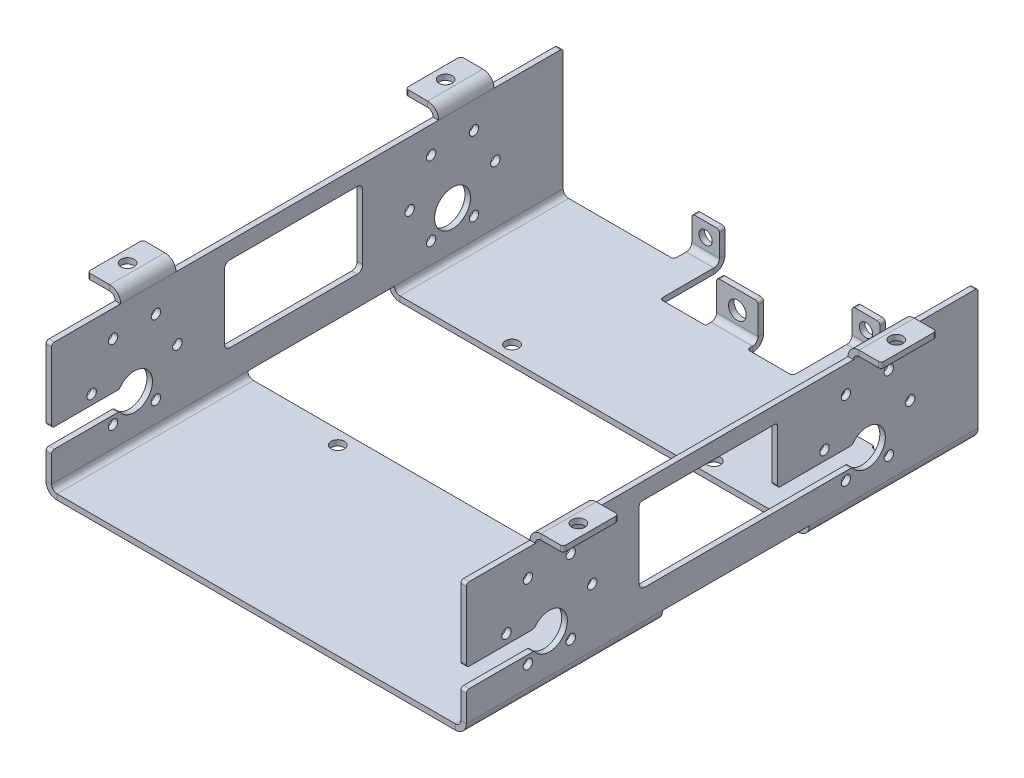
from build123d import *

# Parameters (mm, degrees)
BASIS_BLECH1_DEPTH                    = 185
SCHNITT_LINEAR_AUSTRAGEN1_DEPTH       = 10
SCHNITT_LINEAR_AUSTRAGEN1_DEPTH_BACK  = 206.224267571
SKIZZE2_R                             = 6.5
SKIZZE5_W                             = 50
SKIZZE5_H                             = 27.5
SCHNITT_LINEAR_AUSTRAGEN3_DEPTH       = 244.813453279
DURCHGANGSLOCH_F_R_M31_D              = 3.4
KANTE_LASCHE1_DEPTH                   = 20
F_4_7_4_79_DURCHMESSER_BOHRUNG1_D     = 4.79
SPIEGELN2_COPY_1_DEPTH                = 20
SPIEGELN2_COPY_2_D                    = 4.79
LINEARES_MUSTER1_COUNT                = 2
LINEARES_MUSTER1_PITCH                = 115
F_4_7_4_79_DURCHMESSER_BOHRUNG2_D     = 4.79
F_4_7_4_79_DURCHMESSER_BOHRUNG2_DEPTH = 10
F_4_7_4_79_DURCHMESSER_BOHRUNG2_TIP   = 1.439061183
SCHNITT_LINEAR_AUSTRAGEN4_DEPTH       = 10
KANTE_LASCHE3_DEPTH                   = 10
KANTE_LASCHE3_START                   = 2
KANTE_LASCHE3_PROFILE_W               = 10
KANTE_LASCHE3_PROFILE_H               = 9
KANTE_LASCHE3_PROFILE_R               = 2.395
KANTE_LASCHE3_FLAT_DEPTH              = 2
SKIZZE44_W                            = 48
SKIZZE44_H                            = 15
SCHNITT_LINEAR_AUSTRAGEN5_DEPTH       = 218.573550782
KANTE_LASCHE4_DEPTH                   = 15
KANTE_LASCHE4_START                   = 2
KANTE_LASCHE4_PROFILE_W               = 15
KANTE_LASCHE4_PROFILE_H               = 11
KANTE_LASCHE4_PROFILE_R               = 3.2
KANTE_LASCHE4_FLAT_DEPTH              = 2
SCHNITT_LINEAR_AUSTRAGEN6_DEPTH       = 218.573550782
SCHNITT_LINEAR_AUSTRAGEN7_DEPTH       = 218.573550782
F_2_0_2_DURCHMESSER_BOHRUNG1_D        = 2
F_2_0_2_DURCHMESSER_BOHRUNG1_DEPTH    = 10
F_2_0_2_DURCHMESSER_BOHRUNG1_TIP      = 0.600860619
VERRUNDUNG2_R                         = 1
SCHNITT_LINEAR_START                  = -4
SCHNITT_LINEAR_AUSTRAGEN8_OUTLINE_W   = 154
SCHNITT_LINEAR_AUSTRAGEN8_OUTLINE_H   = 53
SCHNITT_LINEAR_AUSTRAGEN8_DEPTH       = 4
VERRUNDUNG4_R                         = 0.2
VERRUNDUNG1_R                         = 2


# Read off the part's stored shape, not the designer's step: Schnitt-Linear austragen8
# Sheet-metal steps are written as plain solids
with BuildPart() as part:
    # Skizze1 → Basis-Blech1 (new body)
    with BuildSketch(Plane.XY):
        with BuildLine():
            Line((-74, 46), (-74, 2))
            ThreePointArc((-74, 2), (-73.414213562, 0.585786438), (-72, 0))
            Line((-72, 0), (72, 0))
            ThreePointArc((72, 0), (73.414213562, 0.585786438), (74, 2))
            Line((74, 2), (74, 46))
            Line((74, 46), (76, 46))
            Line((76, 46), (76, 2))
            ThreePointArc((76, 2), (74.828427125, -0.828427125), (72, -2))
            Line((72, -2), (-72, -2))
            ThreePointArc((-72, -2), (-74.828427125, -0.828427125), (-76, 2))
            Line((-76, 2), (-76, 46))
            Line((-76, 46), (-74, 46))
        make_face()
    extrude(amount=-BASIS_BLECH1_DEPTH)

    # Skizze2 → Schnitt-Linear austragen1 (cut, two sides: drawn at the far end of the back side and taken through both)
    with BuildSketch(Plane(origin=(0, 0, 0), x_dir=(0, 0, -1), z_dir=(1, 0, 0)).offset(-SCHNITT_LINEAR_AUSTRAGEN1_DEPTH_BACK)):
        with Locations((145, 16)):
            Circle(SKIZZE2_R)
        with BuildLine():
            Line((0, 12.5), (24.522774425, 12.5))
            ThreePointArc((24.522774425, 12.5), (36.5, 16), (24.522774425, 19.5))
            Line((24.522774425, 19.5), (0, 19.5))
            Line((0, 19.5), (0, 12.5))
        make_face()
    extrude(amount=SCHNITT_LINEAR_AUSTRAGEN1_DEPTH + SCHNITT_LINEAR_AUSTRAGEN1_DEPTH_BACK, mode=Mode.SUBTRACT)

    # Skizze5 → Schnitt-Linear austragen3 (cut, through all)
    with BuildSketch(Plane(origin=(76, 0, 0), x_dir=(0, 0, -1), z_dir=(1, 0, 0))):
        with Locations((87.5, 26.25)):
            Rectangle(SKIZZE5_W, SKIZZE5_H)
    extrude(amount=-SCHNITT_LINEAR_AUSTRAGEN3_DEPTH, mode=Mode.SUBTRACT)

    # Durchgangsloch für M31 (through all)
    with Locations(Plane(origin=(76, 0, 0), x_dir=(0, 0, -1), z_dir=(1, 0, 0))):
        with Locations((22.25, 36.423393759), (37.75, 36.423393759), (45.5, 23), (37.75, 9.576606241), (22.25, 9.576606241), (14.5, 23)):
            durchgangsloch_f_r_m31 = Hole(DURCHGANGSLOCH_F_R_M31_D / 2)

    # Kante-Lasche1 section (across the edge) → Kante-Lasche1 (add)
    with BuildSketch(Plane(origin=(-76, 48, -25), x_dir=(0, -1, 0), z_dir=(0, 0, -1))):
        with BuildLine():
            Line((-2, 2), (-2, 10))
            Line((-2, 10), (0, 10))
            Line((0, 10), (0, 2))
            ThreePointArc((0, 2), (0.585786438, 0.585786438), (2, 0))
            Line((2, 0), (2, -2))
            ThreePointArc((2, -2), (-0.828427125, -0.828427125), (-2, 2))
        make_face()
    kante_lasche1 = extrude(amount=KANTE_LASCHE1_DEPTH)

    # Ø4.7 (4.79) Durchmesser Bohrung1 (through all)
    with Locations(Plane(origin=(0, 50, 0), x_dir=(1, 0, 0), z_dir=(0, 1, 0))):
        with Locations((-81.5, 35)):
            f_4_7_4_79_durchmesser_bohrung1 = Hole(F_4_7_4_79_DURCHMESSER_BOHRUNG1_D / 2)

    # Spiegeln1: Kante-Lasche1, Ø4.7 (4.79) Durchmesser Bohrung1 across plane
    add(kante_lasche1.mirror(Plane(origin=(0, 0, 0), x_dir=(0, 0, 1), z_dir=(1, 0, 0))))
    add(f_4_7_4_79_durchmesser_bohrung1.mirror(Plane(origin=(0, 0, 0), x_dir=(0, 0, 1), z_dir=(1, 0, 0))), mode=Mode.SUBTRACT)

    # Spiegeln2: Kante-Lasche1, Ø4.7 (4.79) Durchmesser Bohrung1 across plane
    add(kante_lasche1.mirror(Plane(origin=(0, 0, -92.5), x_dir=(1, 0, 0), z_dir=(0, 0, -1))))
    add(f_4_7_4_79_durchmesser_bohrung1.mirror(Plane(origin=(0, 0, -92.5), x_dir=(1, 0, 0), z_dir=(0, 0, -1))), mode=Mode.SUBTRACT)

    # Spiegeln2 copy 1 sketch → Spiegeln2 copy 1 (add)
    with BuildSketch(Plane(origin=(76, 48, -160), x_dir=(0, -1, 0), z_dir=(0, 0, 1))):
        with BuildLine():
            Line((-2, 2), (-2, 10))
            Line((-2, 10), (0, 10))
            Line((0, 10), (0, 2))
            ThreePointArc((0, 2), (0.585786438, 0.585786438), (2, 0))
            Line((2, 0), (2, -2))
            ThreePointArc((2, -2), (-0.828427125, -0.828427125), (-2, 2))
        make_face()
    extrude(amount=SPIEGELN2_COPY_1_DEPTH)

    # Spiegeln2 copy 2 (through all)
    with Locations(Plane(origin=(0, 50, -185), x_dir=(-1, 0, 0), z_dir=(0, 1, 0))):
        with Locations((-81.5, 35)):
            Hole(SPIEGELN2_COPY_2_D / 2)

    # Lineares Muster1: Durchgangsloch für M31 ×2
    with Locations(*[(0, 0, -i * LINEARES_MUSTER1_PITCH) for i in range(1, LINEARES_MUSTER1_COUNT)]):
        add(durchgangsloch_f_r_m31, mode=Mode.SUBTRACT)

    # Ø4.7 (4.79) Durchmesser Bohrung2
    with Locations(Plane(origin=(0, 0, 0), x_dir=(1, 0, 0), z_dir=(0, 1, 0))):
        with Locations((36.5, 129), (-36.5, 129), (-36.5, 66), (36.5, 66)):
            Hole(F_4_7_4_79_DURCHMESSER_BOHRUNG2_D / 2, depth=F_4_7_4_79_DURCHMESSER_BOHRUNG2_DEPTH)
            with Locations((0, 0, -(F_4_7_4_79_DURCHMESSER_BOHRUNG2_DEPTH + F_4_7_4_79_DURCHMESSER_BOHRUNG2_TIP / 2))):  # 118° drill point
                Cone(0, F_4_7_4_79_DURCHMESSER_BOHRUNG2_D / 2, F_4_7_4_79_DURCHMESSER_BOHRUNG2_TIP, mode=Mode.SUBTRACT)

    # Skizze31 → Schnitt-Linear austragen4 (cut)
    with BuildSketch(Plane.XZ.offset(2)):
        with BuildLine():
            Line((61.55, -177.3), (38.45, -177.3))
            Line((38.45, -177.3), (38.45, -171))
            Line((38.45, -171), (35.75, -171))
            ThreePointArc((35.75, -171), (34.75, -170), (35.75, -169))
            Line((35.75, -169), (38.45, -169))
            Line((38.45, -169), (38.45, -162.7))
            Line((38.45, -162.7), (61.55, -162.7))
            Line((61.55, -162.7), (61.55, -169))
            Line((61.55, -169), (64.25, -169))
            ThreePointArc((64.25, -169), (65.25, -170), (64.25, -171))
            Line((64.25, -171), (61.55, -171))
            Line((61.55, -171), (61.55, -177.3))
        make_face()
    extrude(amount=-SCHNITT_LINEAR_AUSTRAGEN4_DEPTH, mode=Mode.SUBTRACT)

    # Kante-Lasche3 bend section (across the edge) → Kante-Lasche3 (add)
    with BuildSketch(Plane(origin=(34, 0, -191.5), x_dir=(0, 0, 1), z_dir=(-1, 0, 0))):
        with BuildLine():
            Line((-2, 2), (0, 2))
            ThreePointArc((0, 2), (0.585786438, 0.585786438), (2, 0))
            Line((2, 0), (6.5, 0))
            Line((6.5, 0), (6.5, -2))
            Line((6.5, -2), (2, -2))
            ThreePointArc((2, -2), (-0.828427125, -0.828427125), (-2, 2))
        make_face()
    kante_lasche3 = extrude(amount=KANTE_LASCHE3_DEPTH)

    # Kante-Lasche3 profile (on flange) → Kante-Lasche3 flat (add)
    with BuildSketch(Plane(origin=(0, 0, -191.5), x_dir=(-1, 0, 0), z_dir=(0, 0, -1)).offset(KANTE_LASCHE3_START)):
        with Locations((-29, 6.5)):
            Rectangle(KANTE_LASCHE3_PROFILE_W, KANTE_LASCHE3_PROFILE_H)
        with Locations((-29, 6)):
            Circle(KANTE_LASCHE3_PROFILE_R, mode=Mode.SUBTRACT)
    kante_lasche3_flat = extrude(amount=-KANTE_LASCHE3_FLAT_DEPTH)

    # Spiegeln3: Kante-Lasche3, Kante-Lasche3 flat across plane
    add(kante_lasche3.mirror(Plane(origin=(0, 0, 0), x_dir=(0, 0, 1), z_dir=(1, 0, 0))))
    add(kante_lasche3_flat.mirror(Plane(origin=(0, 0, 0), x_dir=(0, 0, 1), z_dir=(1, 0, 0))))

    # Skizze44 → Schnitt-Linear austragen5 (cut, through all)
    with BuildSketch(Plane(origin=(0, 0, 0), x_dir=(1, 0, 0), z_dir=(0, 1, 0))):
        with Locations((0, 177.5)):
            Rectangle(SKIZZE44_W, SKIZZE44_H)
    extrude(amount=-SCHNITT_LINEAR_AUSTRAGEN5_DEPTH, mode=Mode.SUBTRACT)

    # Kante-Lasche4 bend section (across the edge) → Kante-Lasche4 (add)
    with BuildSketch(Plane(origin=(7.5, 0, -174), x_dir=(0, 0, 1), z_dir=(-1, 0, 0))):
        with BuildLine():
            Line((-2, 2), (0, 2))
            ThreePointArc((0, 2), (0.585786438, 0.585786438), (2, 0))
            Line((2, 0), (4, 0))
            Line((4, 0), (4, -2))
            Line((4, -2), (2, -2))
            ThreePointArc((2, -2), (-0.828427125, -0.828427125), (-2, 2))
        make_face()
    extrude(amount=KANTE_LASCHE4_DEPTH)

    # Kante-Lasche4 profile (on flange) → Kante-Lasche4 flat (add)
    with BuildSketch(Plane(origin=(0, 0, -174), x_dir=(-1, 0, 0), z_dir=(0, 0, -1)).offset(KANTE_LASCHE4_START)):
        with Locations((0, 7.5)):
            Rectangle(KANTE_LASCHE4_PROFILE_W, KANTE_LASCHE4_PROFILE_H)
        with Locations((0, 6.5)):
            Circle(KANTE_LASCHE4_PROFILE_R, mode=Mode.SUBTRACT)
    extrude(amount=-KANTE_LASCHE4_FLAT_DEPTH)

    # Skizze2<2> → Schnitt-Linear austragen6 (cut, through all)
    with BuildSketch(Plane(origin=(0, 0, 0), x_dir=(0, 0, -1), z_dir=(1, 0, 0))):
        with BuildLine():
            Line((0, 12.5), (24.522774425, 12.5))
            ThreePointArc((24.522774425, 12.5), (36.5, 16), (24.522774425, 19.5))
            Line((24.522774425, 19.5), (0, 19.5))
            Line((0, 19.5), (0, 12.5))
        make_face()
    extrude(amount=SCHNITT_LINEAR_AUSTRAGEN6_DEPTH, mode=Mode.SUBTRACT)

    # Skizze48 → Schnitt-Linear austragen7 (cut, through all)
    with BuildSketch(Plane(origin=(0, 0, 0), x_dir=(0, 0, -1), z_dir=(1, 0, 0))):
        with BuildLine():
            Line((139.522774425, 19.5), (112.5, 19.5))
            Line((112.5, 19.5), (112.5, 12.5))
            Line((112.5, 12.5), (139.522774425, 12.5))
            ThreePointArc((139.522774425, 12.5), (151.5, 16), (139.522774425, 19.5))
        make_face()
    extrude(amount=SCHNITT_LINEAR_AUSTRAGEN7_DEPTH, mode=Mode.SUBTRACT)

    # Ø2.0 (2) Durchmesser Bohrung1
    with Locations(Plane(origin=(0, 0, 0), x_dir=(1, 0, 0), z_dir=(0, 1, 0))):
        with Locations((38.45, 162.7), (61.55, 162.7), (61.55, 177.3), (38.45, 177.3)):
            Hole(F_2_0_2_DURCHMESSER_BOHRUNG1_D / 2, depth=F_2_0_2_DURCHMESSER_BOHRUNG1_DEPTH)
            with Locations((0, 0, -(F_2_0_2_DURCHMESSER_BOHRUNG1_DEPTH + F_2_0_2_DURCHMESSER_BOHRUNG1_TIP / 2))):  # 118° drill point
                Cone(0, F_2_0_2_DURCHMESSER_BOHRUNG1_D / 2, F_2_0_2_DURCHMESSER_BOHRUNG1_TIP, mode=Mode.SUBTRACT)

    # Verrundung2
    verrundung2_edges = [part.edges().sort_by_distance(p)[0] for p in [
        (-75, 46, 0),
        (75, 46, 0),
        (-86, 49, -25),
        (-86, 49, -45),
        (86, 49, -45),
        (86, 49, -25),
        (86, 49, -160),
        (86, 49, -140),
        (-86, 49, -140),
        (-86, 49, -160),
        (-75, 46, -185),
        (34, -1, -185),
        (34, 11, -192.5),
        (24, 11, -192.5),
        (-34, -1, -185),
        (-24, 11, -192.5),
        (-34, 11, -192.5),
        (24, -1, -170),
        (-24, -1, -170),
        (-75, 12.5, 0),
        (-75, 19.5, -24.522774425),
        (-75, 19.5, 0),
        (7.5, -1, -170),
        (-75, 12.5, -24.522774425),
        (7.5, 13, -175),
        (-7.5, 13, -175),
        (75, 19.5, 0),
        (75, 12.5, 0),
        (75, 12.5, -24.522774425),
        (75, 19.5, -24.522774425),
        (75, 19.5, -112.5),
        (75, 12.5, -139.522774425),
        (75, 19.5, -139.522774425),
        (75, 40, -62.5),
        (75, 46, -185),
        (75, 40, -112.5),
    ]]
    fillet(verrundung2_edges, radius=VERRUNDUNG2_R)

    # Schnitt-Linear austragen8 outline → Schnitt-Linear austragen8 (cut)
    with BuildSketch(Plane.XZ.offset(2).offset(SCHNITT_LINEAR_START)):
        with Locations((0, -97.5)):
            Rectangle(SCHNITT_LINEAR_AUSTRAGEN8_OUTLINE_W, SCHNITT_LINEAR_AUSTRAGEN8_OUTLINE_H)
    extrude(amount=SCHNITT_LINEAR_AUSTRAGEN8_DEPTH, mode=Mode.SUBTRACT)

    # Verrundung4
    verrundung4_edges = [part.edges().sort_by_distance(p)[0] for p in [
        (61.55, -1, -171),
        (38.45, -1, -171),
        (38.45, -1, -169),
        (61.55, -1, -169),
        (38.45, -1, -176.3),
        (39.45, -1, -177.3),
        (61.55, -1, -176.3),
        (60.55, -1, -177.3),
        (60.55, -1, -162.7),
        (61.55, -1, -163.7),
        (38.45, -1, -163.7),
        (39.45, -1, -162.7),
    ]]
    fillet(verrundung4_edges, radius=VERRUNDUNG4_R)

    # Verrundung1
    verrundung1_edges = [part.edges().sort_by_distance(p)[0] for p in [
        (-75, 12.5, -62.5),
        (75, 12.5, -62.5),
        (-75, 40, -62.5),
        (-75, 40, -112.5),
        (-75, 12.5, -112.5),
    ]]
    fillet(verrundung1_edges, radius=VERRUNDUNG1_R)


solid = part.part
